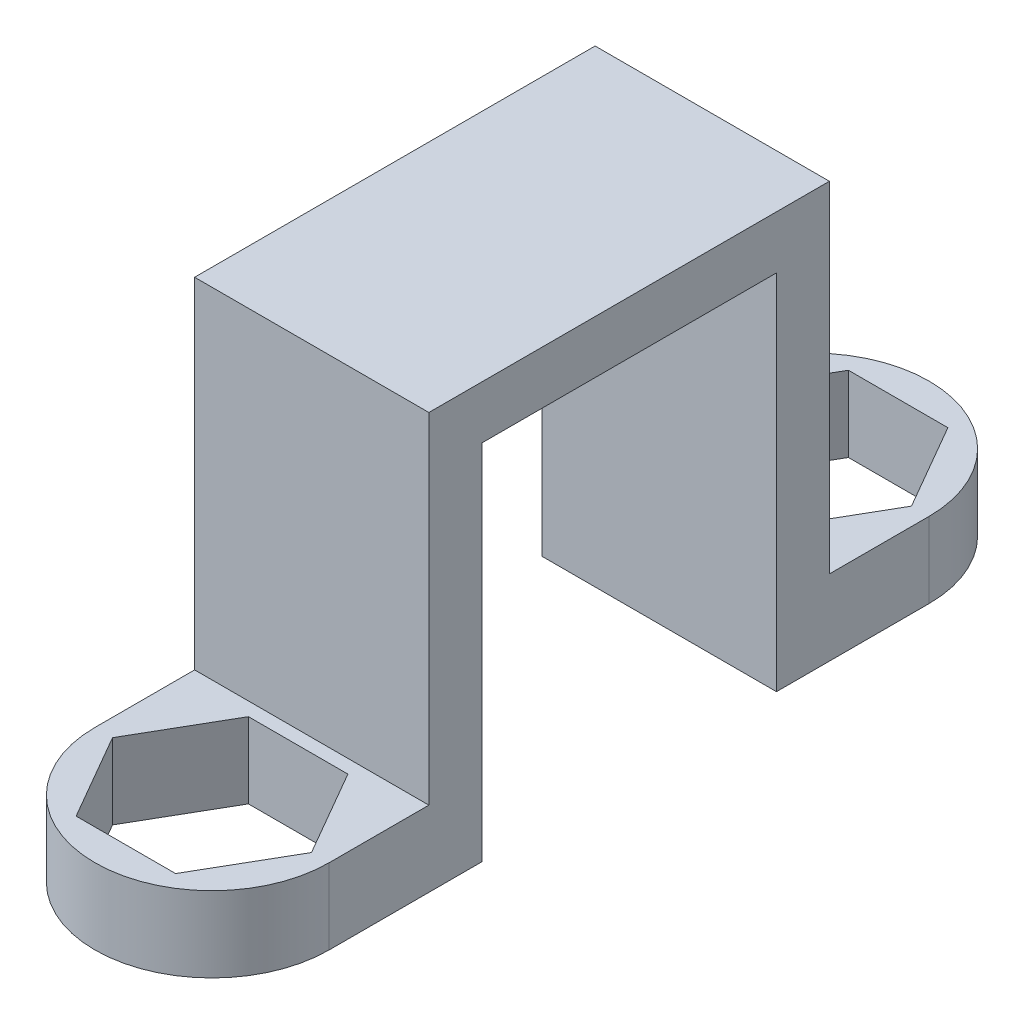
from build123d import *

# Parameters (mm, degrees)
BOSS_EXTRUDE1_DEPTH = 7.75
BOSS_EXTRUDE2_DEPTH = 2.5


with BuildPart() as part:
    # Sketch1 → Boss-Extrude1 (new body)
    with BuildSketch(Plane(origin=(0, 0, 0), x_dir=(0, 0, -1), z_dir=(1, 0, 0))):
        Polygon((-4.875, -6.875), (-4.875, 5.125), (4.875, 5.125), (4.875, -6.875), (6.625, -6.875), (6.625, 6.875), (-6.625, 6.875), (-6.625, -6.875), align=None)
    extrude(amount=BOSS_EXTRUDE1_DEPTH)

    # Sketch2 → Boss-Extrude2 (add)
    with BuildSketch(Plane.XZ.offset(6.875)):
        with BuildLine():
            Line((0, 9.925), (0, 6.625))
            Line((0, 6.625), (7.75, 6.625))
            Line((7.75, 6.625), (7.75, 9.925))
            ThreePointArc((7.75, 9.925), (3.875, 13.8), (0, 9.925))
        make_face()
        Polygon((0.584103466, 9.925), (2.229551733, 12.775), (5.520448267, 12.775), (7.165896534, 9.925), (5.520448267, 7.075), (2.229551733, 7.075), align=None, mode=Mode.SUBTRACT)
    boss_extrude2 = extrude(amount=-BOSS_EXTRUDE2_DEPTH)

    # Mirror1: Boss-Extrude2 across plane
    add(boss_extrude2.mirror(Plane.XY))


solid = part.part
